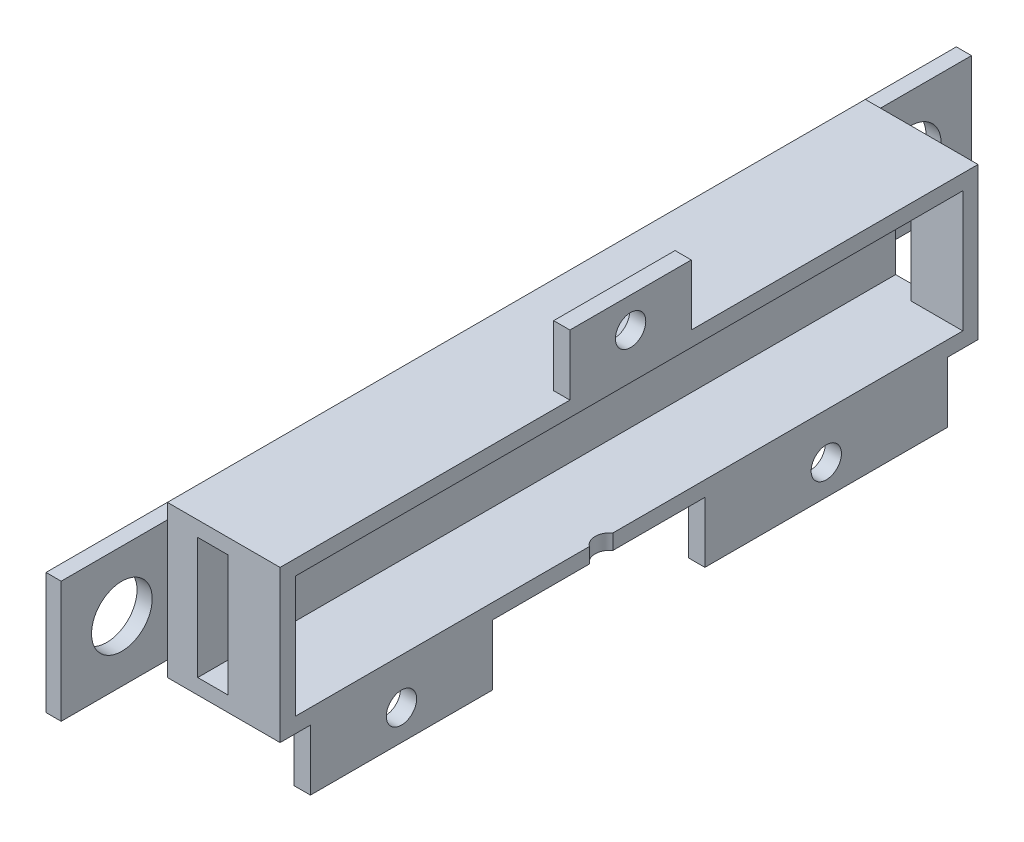
from build123d import *

# Parameters (mm, degrees)
SKETCH1_W               = 190.5
SKETCH1_H               = 25.4
SKETCH1_R               = 6.35
BOSS_EXTRUDE1_DEPTH     = 3.175
SKETCH2_W               = 146.05
SKETCH2_H               = 3.175
BOSS_EXTRUDE2_DEPTH     = 47.625
BOSS_EXTRUDE2_2_DEPTH   = 47.625
SKETCH3_W               = 146.05
SKETCH3_H               = 25.4
BOSS_EXTRUDE4_DEPTH     = 6.35
SKETCH4_W               = 3.175
SKETCH4_H               = 25.4
BOSS_EXTRUDE5_DEPTH     = 41.275
SKETCH5_W               = 6.35
SKETCH5_H               = 25.4
CUT_EXTRUDE1_DEPTH      = 165.45
SKETCH7_W               = 146.05
SKETCH7_H               = 31.75
BOSS_EXTRUDE7_DEPTH     = 3.175
FILLET1_R               = 10
SKETCH8_R               = 3.05
CUT_EXTRUDE2_DEPTH      = 3.175
SKETCH9_W               = 6.35
SKETCH9_H               = 38.1
SKETCH9_H_2             = 50.8
BOSS_EXTRUDE8_DEPTH     = 12.7
SKETCH10_R              = 3.175
CUT_EXTRUDE3_DEPTH      = 12.7
SKETCH11_W              = 6.35
SKETCH11_H              = 25.4
BOSS_EXTRUDE9_DEPTH     = 12.7
SKETCH12_R              = 3.175
CUT_EXTRUDE4_DEPTH      = 12.7
CUT_EXTRUDE5_DEPTH      = 50.8
CUT_EXTRUDE5_DEPTH_BACK = 50.8
SKETCH13_W              = 28.740264125
SKETCH13_H              = 146.120317421


with BuildPart() as part:
    # Sketch1 → Boss-Extrude1 (new body)
    with BuildSketch(Plane(origin=(0, 0, 0), x_dir=(0, 0, -1), z_dir=(1, 0, 0))):
        with Locations((-50.270833333, 2.116666667)):
            Rectangle(SKETCH1_W, SKETCH1_H)
        with Locations((-132.820833333, 2.116666667)):
            Circle(SKETCH1_R, mode=Mode.SUBTRACT)
        with Locations((32.279166667, 2.116666667)):
            Circle(SKETCH1_R, mode=Mode.SUBTRACT)
    extrude(amount=BOSS_EXTRUDE1_DEPTH)



with BuildPart() as body_2:
    # Sketch2 → Boss-Extrude2 (new body)
    with BuildSketch(Plane(origin=(3.175, 0, 0), x_dir=(0, 0, -1), z_dir=(1, 0, 0))):
        with Locations((-50.270833333, 16.404166667)):
            Rectangle(SKETCH2_W, SKETCH2_H)
    extrude(amount=BOSS_EXTRUDE2_DEPTH)


with BuildPart() as body_3:
    # Sketch2 → Boss-Extrude2 2 (new body)
    with BuildSketch(Plane(origin=(3.175, 0, 0), x_dir=(0, 0, -1), z_dir=(1, 0, 0))):
        with Locations((-50.270833333, -12.170833333)):
            Rectangle(SKETCH2_W, SKETCH2_H)
    extrude(amount=BOSS_EXTRUDE2_2_DEPTH)


with BuildPart() as part_1:
    add(part.part)

    add(body_2.part)  # Boss-Extrude4 merges body 2

    add(body_3.part)  # Boss-Extrude4 merges body 3
    # Sketch3 → Boss-Extrude4 (add)
    with BuildSketch(Plane(origin=(3.175, 0, 0), x_dir=(0, 0, -1), z_dir=(1, 0, 0))):
        with Locations((-50.270833333, 2.116666667)):
            Rectangle(SKETCH3_W, SKETCH3_H)
    extrude(amount=BOSS_EXTRUDE4_DEPTH)

    # Sketch4 → Boss-Extrude5 (add)
    with BuildSketch(Plane(origin=(9.525, 0, 0), x_dir=(0, 0, -1), z_dir=(1, 0, 0))):
        with Locations((-121.708333333, 2.116666667)):
            Rectangle(SKETCH4_W, SKETCH4_H)
        with Locations((21.166666667, 2.116666667)):
            Rectangle(SKETCH4_W, SKETCH4_H)
    extrude(amount=BOSS_EXTRUDE5_DEPTH)

    # Sketch5 → Cut-Extrude1 (cut)
    with BuildSketch(Plane.XY.offset(123.295833333)):
        with Locations((12.7, 2.116666667)):
            Rectangle(SKETCH5_W, SKETCH5_H)
    extrude(amount=-CUT_EXTRUDE1_DEPTH, mode=Mode.SUBTRACT)

    # Sketch7 → Boss-Extrude7 (add)
    with BuildSketch(Plane(origin=(50.8, 0, 0), x_dir=(0, 0, -1), z_dir=(1, 0, 0))):
        with Locations((-50.270833333, 2.116666667)):
            Rectangle(SKETCH7_W, SKETCH7_H)
    extrude(amount=BOSS_EXTRUDE7_DEPTH)

    # Fillet1
    fillet1_edges = [part_1.edges().sort_by_distance(p)[0] for p in [
        (53.975, 17.991666667, 50.270833333),
        (53.975, 2.116666667, -22.754166667),
        (53.975, -13.758333333, 50.270833333),
        (53.975, 2.116666667, 123.295833333),
    ]]
    fillet(fillet1_edges, radius=FILLET1_R)

    # Sketch8 → Cut-Extrude2 (cut)
    with BuildSketch(Plane.XZ.offset(13.758333333)):
        with Locations((28.575, 56.120833333)):
            Circle(SKETCH8_R)
    extrude(amount=-CUT_EXTRUDE2_DEPTH, mode=Mode.SUBTRACT)

    # Sketch9 → Boss-Extrude8 (add)
    with BuildSketch(Plane.XZ.offset(13.758333333)):
        with Locations((26.541679323, 97.895833333)):
            Rectangle(SKETCH9_W, SKETCH9_H)
        with Locations((26.541679323, 8.995833333)):
            Rectangle(SKETCH9_W, SKETCH9_H_2)
    extrude(amount=BOSS_EXTRUDE8_DEPTH)

    # Sketch10 → Cut-Extrude3 (cut)
    with BuildSketch(Plane(origin=(29.716679323, 0, 0), x_dir=(0, 0, -1), z_dir=(1, 0, 0))):
        with Locations((-97.895833333, -20.108333333)):
            Circle(SKETCH10_R)
        with Locations((-8.995833333, -20.108333333)):
            Circle(SKETCH10_R)
    extrude(amount=-CUT_EXTRUDE3_DEPTH, mode=Mode.SUBTRACT)

    # Sketch11 → Boss-Extrude9 (add)
    with BuildSketch(Plane(origin=(0, 17.991666667, 0), x_dir=(1, 0, 0), z_dir=(0, 1, 0))):
        with Locations((26.54, -49.945833333)):
            Rectangle(SKETCH11_W, SKETCH11_H)
    extrude(amount=BOSS_EXTRUDE9_DEPTH)

    # Sketch12 → Cut-Extrude4 (cut)
    with BuildSketch(Plane(origin=(29.715, 0, 0), x_dir=(0, 0, -1), z_dir=(1, 0, 0))):
        with Locations((-49.945833333, 24.341666667)):
            Circle(SKETCH12_R)
    extrude(amount=-CUT_EXTRUDE4_DEPTH, mode=Mode.SUBTRACT)

    # Sketch13 → Cut-Extrude5 (cut, two sides: drawn at the far end of the back side and taken through both)
    with BuildSketch(Plane.XZ.offset(13.758333333).offset(-CUT_EXTRUDE5_DEPTH_BACK)):
        with Locations((41.13133077, 50.235674622)):
            Rectangle(SKETCH13_W, SKETCH13_H)
    extrude(amount=CUT_EXTRUDE5_DEPTH + CUT_EXTRUDE5_DEPTH_BACK, mode=Mode.SUBTRACT)


solid = part_1.part
